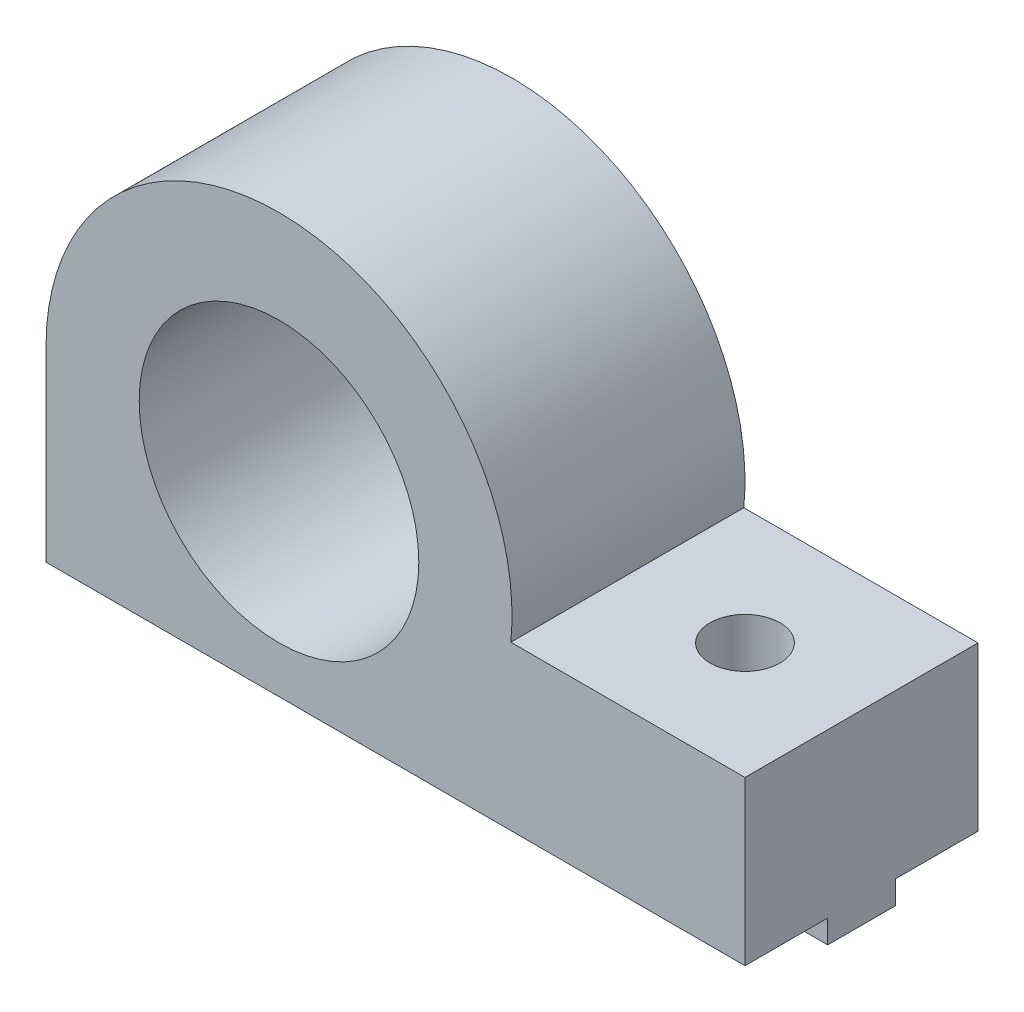
from build123d import *

# Parameters (mm, degrees)
SKETCH1_R                       = 6
MAIN_DEPTH                      = 10
SKETCH3_W                       = 30
SKETCH3_H                       = 2.9
MAKERBEAMRECTANGULARGUIDE_DEPTH = 1
SKETCH4_R                       = 1.5
MAKERBEAMFIXHOLE_DEPTH          = 25.919871589


with BuildPart() as part:
    # Sketch1 → Main (new body)
    with BuildSketch(Plane.XY):
        with BuildLine():
            Line((-10, 0), (-10, -8))
            Line((-10, -8), (20, -8))
            Line((20, -8), (20, -1))
            Line((20, -1), (9.949874371, -1))
            ThreePointArc((9.949874371, -1), (0.500627751, 9.987460731), (-10, 0))
        make_face()
        Circle(SKETCH1_R, mode=Mode.SUBTRACT)
    extrude(amount=MAIN_DEPTH)

    # Sketch3 → MakerBeamRectangularGuide (add)
    with BuildSketch(Plane(origin=(0, -8, 0), x_dir=(-1, 0, 0), z_dir=(0, -1, 0))):
        with Locations((-5, -5)):
            Rectangle(SKETCH3_W, SKETCH3_H)
    extrude(amount=MAKERBEAMRECTANGULARGUIDE_DEPTH)

    # Sketch4 → MakerBeamFixHole (cut, through all)
    with BuildSketch(Plane(origin=(0, -1, 0), x_dir=(1, 0, 0), z_dir=(0, 1, 0))):
        with Locations((15, -5)):
            Circle(SKETCH4_R)
    extrude(amount=-MAKERBEAMFIXHOLE_DEPTH, mode=Mode.SUBTRACT)


solid = part.part
